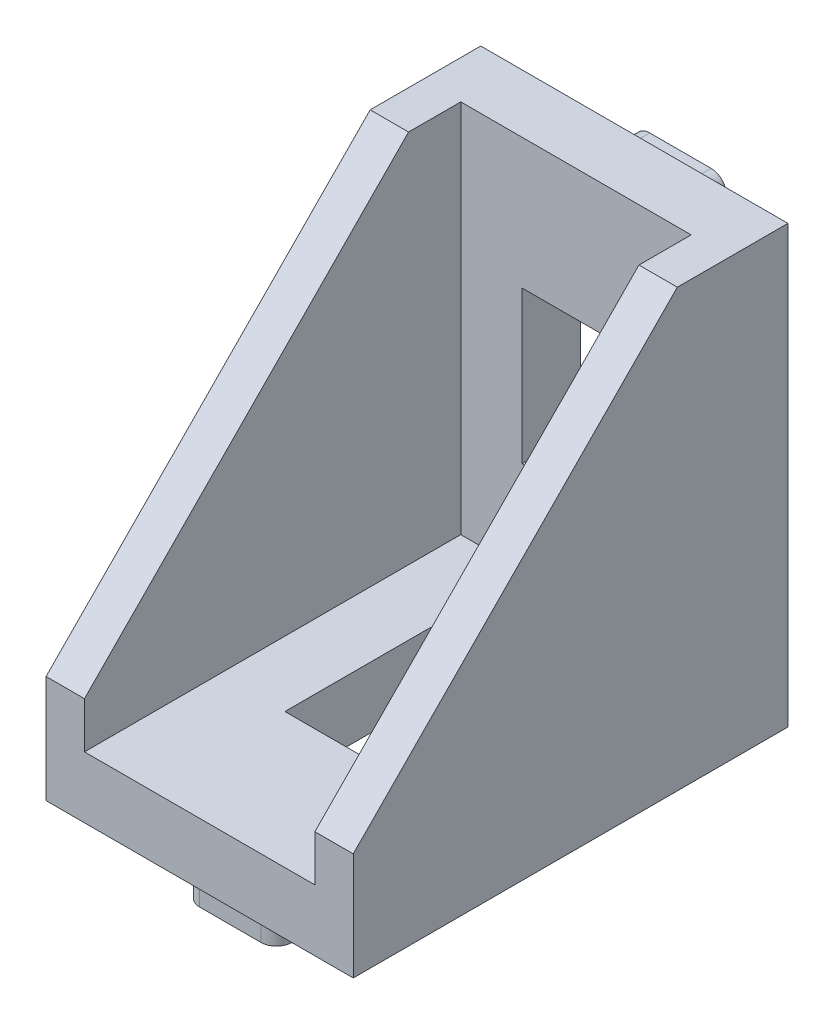
from build123d import *

# Parameters (mm, degrees)
SKETCH1_W                      = 20
SKETCH1_H                      = 28.4
BACK_WALL_DEPTH                = 3.8
SKETCH3_W                      = 20
SKETCH3_H                      = 4
BOTTOM_WALL_DEPTH              = 24.5
LEFT_WALL_DEPTH                = 2.5
SKETCH6_W                      = 6.5
SKETCH6_H                      = 9.5
BOTTOM_CONNECTION_CUTOUT_DEPTH = 11
SKETCH7_W                      = 7
SKETCH7_H                      = 9.9
TOP_CONNECTION_CUTOUT_DEPTH    = 11
SKETCH8_W                      = 6
SKETCH8_H                      = 2
BOTTOM_NOTCH_DEPTH             = 3
SKETCH9_W                      = 6
SKETCH9_H                      = 2
TOP_NOTCH_DEPTH                = 3
FILLET1_R                      = 1
BOTTOM_LIGHTENING_CUTOUT_DEPTH = 3
CUT_EXTRUDE2_DEPTH             = 2


with BuildPart() as part:
    # Sketch1 → back_wall (new body)
    with BuildSketch(Plane.XY):
        Rectangle(SKETCH1_W, SKETCH1_H)
    extrude(amount=BACK_WALL_DEPTH)

    # Sketch3 → bottom_wall (add)
    with BuildSketch(Plane.XY.offset(3.8)):
        with Locations((0, -12.2)):
            Rectangle(SKETCH3_W, SKETCH3_H)
    extrude(amount=BOTTOM_WALL_DEPTH)

    # Sketch4 → left_wall (add)
    with BuildSketch(Plane.ZY.offset(10)):
        Polygon((3.8, 14.2), (7.2, 14.2), (28.3, -7.2), (28.3, -10.2), (3.8, -10.2), align=None)
    left_wall = extrude(amount=-LEFT_WALL_DEPTH)

    # right_wall: left_wall across plane
    add(left_wall.mirror(Plane(origin=(0, 0, 0), x_dir=(0, 0, 1), z_dir=(1, 0, 0))))

    # Sketch6 → bottom_connection_cutout (cut)
    with BuildSketch(Plane(origin=(0, -10.2, 0), x_dir=(1, 0, 0), z_dir=(0, 1, 0))):
        with Locations((0, -14.75)):
            Rectangle(SKETCH6_W, SKETCH6_H)
    extrude(amount=-BOTTOM_CONNECTION_CUTOUT_DEPTH, mode=Mode.SUBTRACT)

    # Sketch7 → top_connection_cutout (cut)
    with BuildSketch(Plane.XY.offset(3.8)):
        with Locations((0, 0.75)):
            Rectangle(SKETCH7_W, SKETCH7_H)
    extrude(amount=-TOP_CONNECTION_CUTOUT_DEPTH, mode=Mode.SUBTRACT)

    # Sketch8 → bottom_notch (add)
    with BuildSketch(Plane.XZ.offset(14.2)):
        with Locations((0, 25.3)):
            Rectangle(SKETCH8_W, SKETCH8_H)
        with Locations((0, 3.3)):
            Rectangle(SKETCH8_W, SKETCH8_H)
    extrude(amount=BOTTOM_NOTCH_DEPTH)

    # Sketch9 → top_notch (add)
    with BuildSketch(Plane(origin=(0, 0, 0), x_dir=(-1, 0, 0), z_dir=(0, 0, -1))):
        with Locations((0, -11.2)):
            Rectangle(SKETCH9_W, SKETCH9_H)
        with Locations((0, 10.8)):
            Rectangle(SKETCH9_W, SKETCH9_H)
    extrude(amount=TOP_NOTCH_DEPTH)

    # Fillet1
    fillet1_edges = [part.edges().sort_by_distance(p)[0] for p in [
        (3, 9.8, -1.5),
        (3, 11.8, -1.5),
        (-3, 11.8, -1.5),
        (-3, 9.8, -1.5),
        (-3, -12.2, -1.5),
        (-3, -10.2, -1.5),
        (3, -10.2, -1.5),
        (3, -12.2, -1.5),
        (3, -15.7, 4.3),
        (3, -15.7, 2.3),
        (-3, -15.7, 4.3),
        (-3, -15.7, 2.3),
        (-3, -15.7, 26.3),
        (-3, -15.7, 24.3),
        (3, -15.7, 26.3),
        (3, -15.7, 24.3),
    ]]
    fillet(fillet1_edges, radius=FILLET1_R - 0.0001)  # a hair under: the kernel refuses the full size

    # Sketch11 → bottom_lightening_cutout (cut)
    with BuildSketch(Plane.XZ.offset(14.2)):
        with BuildLine():
            Line((2, 2.3), (6, 2.3))
            Line((6, 2.3), (6, 8.3))
            Line((6, 8.3), (-6, 8.3))
            Line((-6, 8.3), (-6, 2.3))
            Line((-6, 2.3), (-2, 2.3))
            ThreePointArc((-2, 2.3), (-2.707106781, 2.592893219), (-3, 3.3))
            ThreePointArc((-3, 3.3), (-2.707106781, 4.007106781), (-2, 4.3))
            Line((-2, 4.3), (2, 4.3))
            ThreePointArc((2, 4.3), (2.707106781, 4.007106781), (3, 3.3))
            ThreePointArc((3, 3.3), (2.707106781, 2.592893219), (2, 2.3))
        make_face()
        with BuildLine():
            Line((-6, 20.3), (6, 20.3))
            Line((6, 20.3), (6, 26.3))
            Line((6, 26.3), (2, 26.3))
            ThreePointArc((2, 26.3), (2.707106781, 26.007106781), (3, 25.3))
            ThreePointArc((3, 25.3), (2.707106781, 24.592893219), (2, 24.3))
            Line((2, 24.3), (-2, 24.3))
            ThreePointArc((-2, 24.3), (-2.707106781, 24.592893219), (-3, 25.3))
            ThreePointArc((-3, 25.3), (-2.707106781, 26.007106781), (-2, 26.3))
            Line((-2, 26.3), (-6, 26.3))
            Line((-6, 26.3), (-6, 20.3))
        make_face()
    extrude(amount=-BOTTOM_LIGHTENING_CUTOUT_DEPTH, mode=Mode.SUBTRACT)

    # Sketch13 → Cut-Extrude2 (cut)
    with BuildSketch(Plane(origin=(0, 0, 0), x_dir=(-1, 0, 0), z_dir=(0, 0, -1))):
        with BuildLine():
            Line((-2, 11.8), (-6, 11.8))
            Line((-6, 11.8), (-6, 7.8))
            Line((-6, 7.8), (6, 7.8))
            Line((6, 7.8), (6, 11.8))
            Line((6, 11.8), (2, 11.8))
            ThreePointArc((2, 11.8), (2.707106781, 11.507106781), (3, 10.8))
            ThreePointArc((3, 10.8), (2.707106781, 10.092893219), (2, 9.8))
            Line((2, 9.8), (-2, 9.8))
            ThreePointArc((-2, 9.8), (-2.707106781, 10.092893219), (-3, 10.8))
            ThreePointArc((-3, 10.8), (-2.707106781, 11.507106781), (-2, 11.8))
        make_face()
        with BuildLine():
            Line((6, -6.2), (-6, -6.2))
            Line((-6, -6.2), (-6, -12.2))
            Line((-6, -12.2), (-2, -12.2))
            ThreePointArc((-2, -12.2), (-2.707106781, -11.907106781), (-3, -11.2))
            ThreePointArc((-3, -11.2), (-2.707106781, -10.492893219), (-2, -10.2))
            Line((-2, -10.2), (2, -10.2))
            ThreePointArc((2, -10.2), (2.707106781, -10.492893219), (3, -11.2))
            ThreePointArc((3, -11.2), (2.707106781, -11.907106781), (2, -12.2))
            Line((2, -12.2), (6, -12.2))
            Line((6, -12.2), (6, -6.2))
        make_face()
    extrude(amount=-CUT_EXTRUDE2_DEPTH, mode=Mode.SUBTRACT)


solid = part.part
